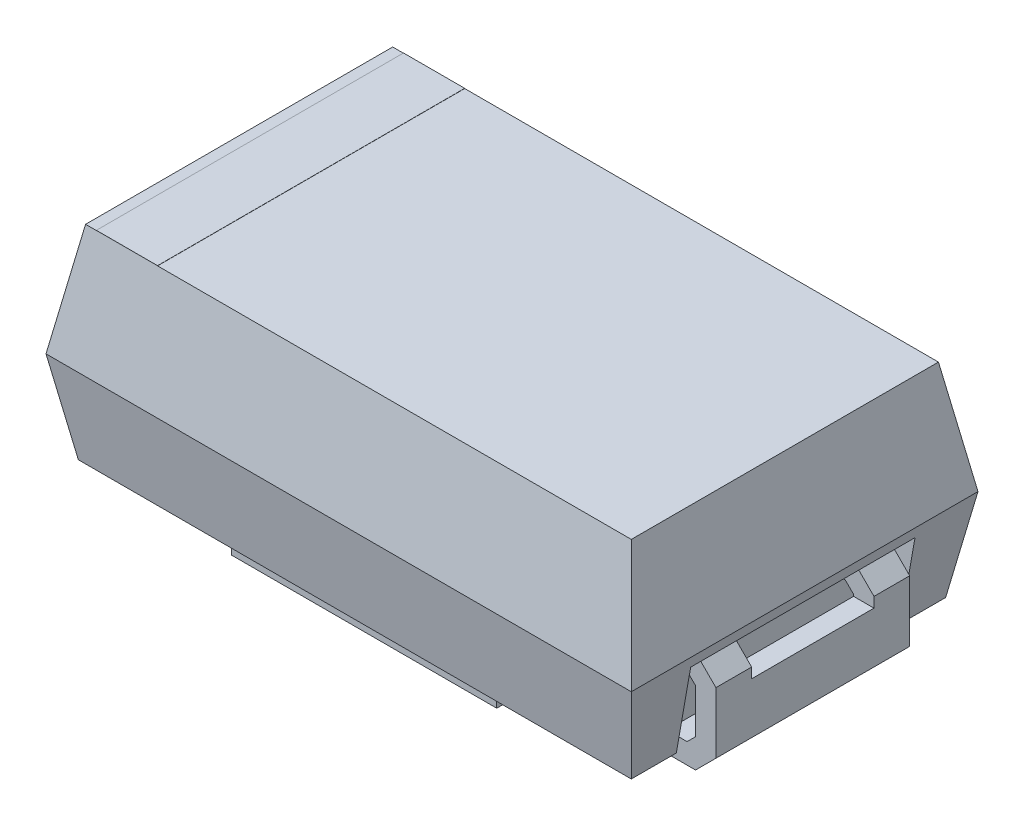
from build123d import *
from OCP.BRepFilletAPI import BRepFilletAPI_MakeChamfer

# Parameters (mm, degrees)
SKETCH2_W                = 4.318
SKETCH2_H                = 2.794
BASE_EXTRUDE_DEPTH       = 7.2898
CHAMFER1_SIZE            = 1.397
CHAMFER1_SIZE2           = 0.246328792
SKETCH3_W                = 2.794
SKETCH3_H                = 1.27
CUT_EXTRUDE1_DEPTH       = 0.508
SKETCH4_W                = 2.794
SKETCH4_H                = 1.27
CUT_EXTRUDE2_DEPTH       = 0.508
SKETCH5_OUTSIDE_W        = 11.073
SKETCH5_OUTSIDE_H        = 8.102
SKETCH5_OUTSIDE_W_2      = 3.302
SKETCH5_OUTSIDE_H_2      = 3.556
CUT_EXTRUDE3_DEPTH       = 0.254
CHAMFER2_SIZE            = 1.397
CHAMFER2_SIZE_2          = 0.246328792
BOSS_EXTRUDE_THIN1_DEPTH = 1.2065
SKETCH7_W                = 1.524
SKETCH7_H                = 0.381
CUT_EXTRUDE4_DEPTH       = 0.508
SKETCH8_W                = 0.762
SKETCH8_H                = 3.825342416
BOSS_EXTRUDE2_DEPTH      = 0.00254


with BuildPart() as part:
    # Sketch2 → Base-Extrude (new body)
    with BuildSketch(Plane(origin=(-0.1524, 0, 0), x_dir=(0, 0, -1), z_dir=(1, 0, 0))):
        with Locations((0, 1.397)):
            Rectangle(SKETCH2_W, SKETCH2_H)
    extrude(amount=BASE_EXTRUDE_DEPTH)

    # Chamfer1: one chamfer whose edges measure the first distance from different faces: ONE call of the kernel's chamfer builder (chamfer() names one face for all edges)
    chamfer1_edges_1 = [part.edges().sort_by_distance(p)[0] for p in [
        (7.1374, 0, 0),
    ]]
    chamfer1_side_1 = [part.faces().sort_by_distance(p)[0] for p in [
        (7.1374, 1.397, 0),
    ]]
    chamfer1_edges_2 = [part.edges().sort_by_distance(p)[0] for p in [
        (-0.1524, 0, 0),
    ]]
    chamfer1_side_2 = [part.faces().sort_by_distance(p)[0] for p in [
        (-0.1524, 1.397, 0),
    ]]
    chamfer1_edges_3 = [part.edges().sort_by_distance(p)[0] for p in [
        (3.4925, 0, -2.159),
    ]]
    chamfer1_side_3 = [part.faces().sort_by_distance(p)[0] for p in [
        (3.4925, 1.397, -2.159),
    ]]
    chamfer1_edges_4 = [part.edges().sort_by_distance(p)[0] for p in [
        (3.4925, 0, 2.159),
    ]]
    chamfer1_side_4 = [part.faces().sort_by_distance(p)[0] for p in [
        (3.4925, 1.397, 2.159),
    ]]
    chamfer1 = BRepFilletAPI_MakeChamfer(part.part.solid().wrapped)
    for e in chamfer1_edges_1:
        chamfer1.Add(CHAMFER1_SIZE, CHAMFER1_SIZE2, e.wrapped, chamfer1_side_1[0].wrapped)  # the first distance lies on this face
    for e in chamfer1_edges_2:
        chamfer1.Add(CHAMFER1_SIZE, CHAMFER1_SIZE2, e.wrapped, chamfer1_side_2[0].wrapped)  # the first distance lies on this face
    for e in chamfer1_edges_3:
        chamfer1.Add(CHAMFER1_SIZE, CHAMFER1_SIZE2, e.wrapped, chamfer1_side_3[0].wrapped)  # the first distance lies on this face
    for e in chamfer1_edges_4:
        chamfer1.Add(CHAMFER1_SIZE, CHAMFER1_SIZE2, e.wrapped, chamfer1_side_4[0].wrapped)  # the first distance lies on this face
    add(Compound.cast(chamfer1.Shape()), mode=Mode.REPLACE)

    # Sketch3 → Cut-Extrude1 (cut)
    with BuildSketch(Plane.ZY.offset(0.1524)):
        with Locations((0, 0.635)):
            Rectangle(SKETCH3_W, SKETCH3_H)
    extrude(amount=-CUT_EXTRUDE1_DEPTH, mode=Mode.SUBTRACT)

    # Sketch4 → Cut-Extrude2 (cut)
    with BuildSketch(Plane(origin=(7.1374, 0, 0), x_dir=(0, 0, -1), z_dir=(1, 0, 0))):
        with Locations((0, 0.635)):
            Rectangle(SKETCH4_W, SKETCH4_H)
    extrude(amount=-CUT_EXTRUDE2_DEPTH, mode=Mode.SUBTRACT)

    # Sketch5 outside → Cut-Extrude3 (cut)
    with BuildSketch(Plane.XZ):
        with Locations((3.4925, 0)):
            Rectangle(SKETCH5_OUTSIDE_W, SKETCH5_OUTSIDE_H)
        with Locations((3.429, 0)):
            Rectangle(SKETCH5_OUTSIDE_W_2, SKETCH5_OUTSIDE_H_2, mode=Mode.SUBTRACT)
    extrude(amount=-CUT_EXTRUDE3_DEPTH, mode=Mode.SUBTRACT)

    # Chamfer2
    chamfer2_edges_1 = [part.edges().sort_by_distance(p)[0] for p in [
        (-0.1524, 2.794, 0),
    ]]
    chamfer2_side_1 = [part.faces().sort_by_distance(p)[0] for p in [
        (-0.1524, 2.789073424, 0),
    ]]
    chamfer2_edges_2 = [part.edges().sort_by_distance(p)[0] for p in [
        (7.1374, 2.794, 0),
    ]]
    chamfer2_side_2 = [part.faces().sort_by_distance(p)[0] for p in [
        (7.132473424, 2.794, 0),
    ]]
    chamfer2_edges_3 = [part.edges().sort_by_distance(p)[0] for p in [
        (3.4925, 2.794, 2.159),
    ]]
    chamfer2_side_3 = [part.faces().sort_by_distance(p)[0] for p in [
        (3.4925, 2.789073424, 2.159),
    ]]
    chamfer2_edges_4 = [part.edges().sort_by_distance(p)[0] for p in [
        (3.4925, 2.794, -2.159),
    ]]
    chamfer2_side_4 = [part.faces().sort_by_distance(p)[0] for p in [
        (3.4925, 2.794, -2.154073424),
    ]]
    chamfer2 = BRepFilletAPI_MakeChamfer(part.part.solid().wrapped)
    for e in chamfer2_edges_1:
        chamfer2.Add(CHAMFER2_SIZE - 0.0001, CHAMFER2_SIZE_2 - 0.0001, e.wrapped, chamfer2_side_1[0].wrapped)
    for e in chamfer2_edges_2:
        chamfer2.Add(CHAMFER2_SIZE_2 - 0.0001, CHAMFER2_SIZE - 0.0001, e.wrapped, chamfer2_side_2[0].wrapped)
    for e in chamfer2_edges_3:
        chamfer2.Add(CHAMFER2_SIZE - 0.0001, CHAMFER2_SIZE_2 - 0.0001, e.wrapped, chamfer2_side_3[0].wrapped)
    for e in chamfer2_edges_4:
        chamfer2.Add(CHAMFER2_SIZE_2 - 0.0001, CHAMFER2_SIZE - 0.0001, e.wrapped, chamfer2_side_4[0].wrapped)
    add(Compound.cast(chamfer2.Shape()), mode=Mode.REPLACE)  # a hair under: the kernel refuses the full size

    # Sketch6 → Boss-Extrude-Thin1 (add, symmetric)
    with BuildSketch(Plane.XY):
        Polygon((0.295515086, 1.267447171), (-0.002552829, 1.267447171), (-0.254, 1.016), (-0.254, 0.254), (0, 0), (1.2954, 0), (1.2954, 0.254), (0.105210245, 0.254), (0, 0.359210245), (0, 0.910789755), (0.102657416, 1.013447171), (0.295515086, 1.013447171), align=None)
    boss_extrude_thin1 = extrude(amount=BOSS_EXTRUDE_THIN1_DEPTH, both=True)

    # Sketch7 → Cut-Extrude4 (cut)
    with BuildSketch(Plane.ZY.offset(0.254)):
        with Locations((0, 1.0795)):
            Rectangle(SKETCH7_W, SKETCH7_H)
    cut_extrude4 = extrude(amount=-CUT_EXTRUDE4_DEPTH, mode=Mode.SUBTRACT)

    # Mirror1: Boss-Extrude-Thin1, Cut-Extrude4 across plane
    add(boss_extrude_thin1.mirror(Plane(origin=(3.4925, 0, 0), x_dir=(0, 0, 1), z_dir=(1, 0, 0))))
    add(cut_extrude4.mirror(Plane(origin=(3.4925, 0, 0), x_dir=(0, 0, 1), z_dir=(1, 0, 0))), mode=Mode.SUBTRACT)

    # Sketch8 → Boss-Extrude2 (add)
    with BuildSketch(Plane(origin=(0, 2.794, 0), x_dir=(-1, 0, 0), z_dir=(0, 1, 0))):
        with Locations((-0.6096, 0)):
            Rectangle(SKETCH8_W, SKETCH8_H)
    extrude(amount=BOSS_EXTRUDE2_DEPTH)


solid = part.part
